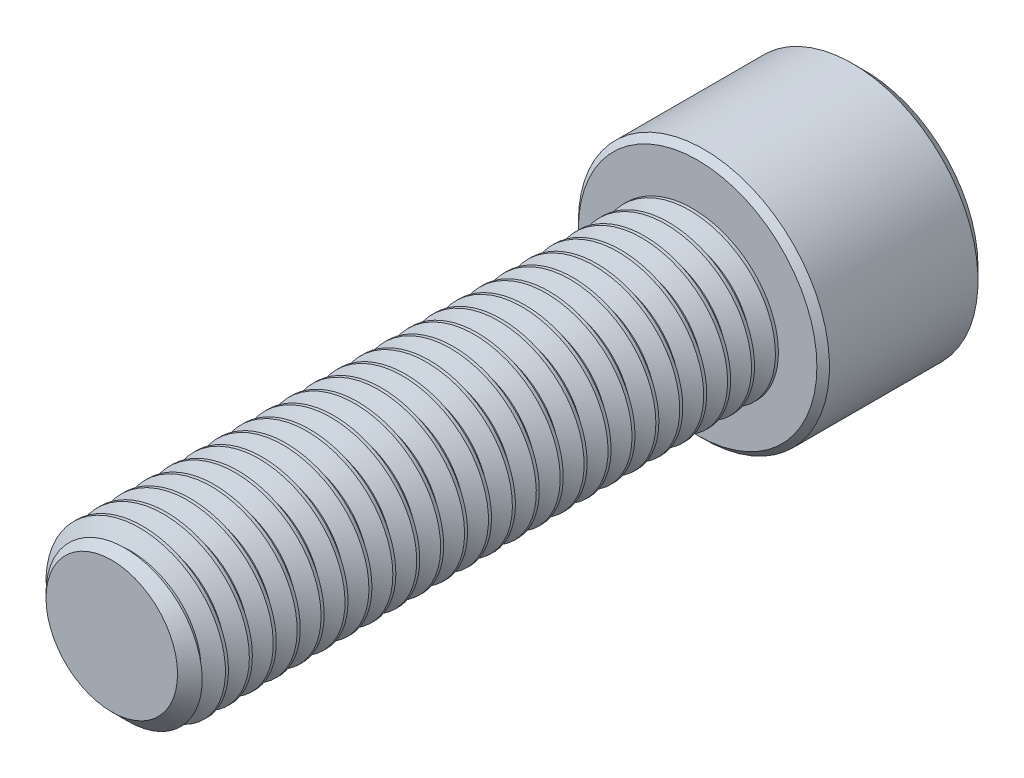
from build123d import *

# Parameters (mm, degrees)
SKETCH1_R          = 3.175
EXTRUDE1_DEPTH     = 22.225
CHAMFER3_SIZE      = 0.680357143
CUT_SWEEP1_PITCH   = 0.907142857
SKETCH6_R          = 4.7625
EXTRUDE2_DEPTH     = 6.35
CUT_EXTRUDE1_DEPTH = 3.571875
CHAMFER1_SIZE      = 0.47625
CHAMFER2_SIZE      = 0.238125


with BuildPart() as part:
    # Sketch1 → Extrude1 (new body)
    with BuildSketch(Plane.XY):
        Circle(SKETCH1_R)
    extrude(amount=-EXTRUDE1_DEPTH)

    # Chamfer3
    chamfer3_edges = [part.edges().sort_by_distance(p)[0] for p in [
        (-3.175, 0, 0),
    ]]
    chamfer(chamfer3_edges, length=CHAMFER3_SIZE)

    # Cut-Sweep1: the profile of Sketch3 profile screwed along a right-hand helix of 25.5 turns, 6 arcs to a turn; built about Z, then put on its axis
    cut_sweep1_z = Axis((0, 0, 0), (0, 0, 1))
    cut_sweep1_corners = [(3.1753, 0, -0.793923205), (2.585793431, 0, -0.453571429), (2.585793431, 0, -0.340178571), (3.1753, 0, 0.000173205)]
    with BuildLine(mode=Mode.PRIVATE) as cut_sweep1_profile:
        Line(cut_sweep1_corners[0], cut_sweep1_corners[1])
        Line(cut_sweep1_corners[1], cut_sweep1_corners[2])
        Line(cut_sweep1_corners[2], cut_sweep1_corners[3])
        Line(cut_sweep1_corners[3], cut_sweep1_corners[0])
    cut_sweep1_cap = Face(cut_sweep1_profile.wire())
    cut_sweep1_turn_angles = [0, 30, 60, 90, 120, 150, 180, 210, 240, 270, 300, 330, 360]
    cut_sweep1_turn_weights = [1, 0.8660254037844387, 1, 0.8660254037844387, 1, 0.8660254037844387, 1, 0.8660254037844387, 1, 0.8660254037844387, 1, 0.8660254037844387, 1]
    cut_sweep1_turn_rails = [Edge.make_bspline([Vector(p[0], p[1], 0).rotate(cut_sweep1_z, cut_sweep1_turn_angles[k]) / cut_sweep1_turn_weights[k] + Vector(0, 0, p[2] + CUT_SWEEP1_PITCH * cut_sweep1_turn_angles[k] / 360) for k in range(13)], [0, 0, 0, 1, 1, 2, 2, 3, 3, 4, 4, 5, 5, 6, 6, 6], 2, cut_sweep1_turn_weights) for p in cut_sweep1_corners]
    cut_sweep1_turn_sides = [Face.make_surface_from_curves(cut_sweep1_turn_rails[p[0]], cut_sweep1_turn_rails[p[1]]) for p in [(0, 1), (1, 2), (2, 3), (3, 0)]]
    cut_sweep1_last_angles = [9000, 9030, 9060, 9090, 9120, 9150, 9180]
    cut_sweep1_last_weights = [1, 0.8660254037844387, 1, 0.8660254037844387, 1, 0.8660254037843355, 1]
    cut_sweep1_last_rails = [Edge.make_bspline([Vector(p[0], p[1], 0).rotate(cut_sweep1_z, cut_sweep1_last_angles[k]) / cut_sweep1_last_weights[k] + Vector(0, 0, p[2] + CUT_SWEEP1_PITCH * cut_sweep1_last_angles[k] / 360) for k in range(7)], [0, 0, 0, 1, 1, 2, 2, 3, 3, 3], 2, cut_sweep1_last_weights) for p in cut_sweep1_corners]
    cut_sweep1_last_sides = [Face.make_surface_from_curves(cut_sweep1_last_rails[p[0]], cut_sweep1_last_rails[p[1]]) for p in [(0, 1), (1, 2), (2, 3), (3, 0)]]
    cut_sweep1 = Plane(origin=(0, 0, 0), x_dir=(0, 1, 0), z_dir=(0, 0, -1)) * Solid(Shell([*[p.moved(Location((0, 0, CUT_SWEEP1_PITCH * i))) for i in range(25) for p in cut_sweep1_turn_sides], *cut_sweep1_last_sides, cut_sweep1_cap, cut_sweep1_cap.rotate(cut_sweep1_z, 9180).moved(Location((0, 0, CUT_SWEEP1_PITCH * 9180 / 360)))]))
    add(cut_sweep1, mode=Mode.SUBTRACT)

    # Sketch6 → Extrude2 (add)
    with BuildSketch(Plane(origin=(0, 0, -22.225), x_dir=(-1, 0, 0), z_dir=(0, 0, -1))):
        Circle(SKETCH6_R)
    extrude(amount=EXTRUDE2_DEPTH)

    # Sketch7 → Cut-Extrude1 (cut)
    with BuildSketch(Plane(origin=(0, 0, -28.575), x_dir=(-1, 0, 0), z_dir=(0, 0, -1))):
        Polygon((0, 2.749630657), (-2.38125, 1.374815329), (-2.38125, -1.374815329), (0, -2.749630657), (2.38125, -1.374815329), (2.38125, 1.374815329), align=None)
    extrude(amount=-CUT_EXTRUDE1_DEPTH, mode=Mode.SUBTRACT)

    # Cut-Extrude2 cone 1 section (through the dimple's axis) → Cut-Extrude2 (revolve, cut)
    with BuildSketch(Plane(origin=(0, 0, -28.575), x_dir=(0, 1, 0), z_dir=(1, 0, 0))):
        Polygon((0, 0), (2.749630657, 0), (0, 2.749630657), align=None)
    revolve(axis=Axis((0, 0, -28.575), (0, 0, 1)), mode=Mode.SUBTRACT)

    # Chamfer1
    chamfer1_edges = [part.edges().sort_by_distance(p)[0] for p in [
        (4.7625, 0, -28.575),
    ]]
    chamfer(chamfer1_edges, length=CHAMFER1_SIZE)

    # Chamfer2
    chamfer2_edges = [part.edges().sort_by_distance(p)[0] for p in [
        (4.7625, 0, -22.225),
    ]]
    chamfer(chamfer2_edges, length=CHAMFER2_SIZE)


solid = part.part
